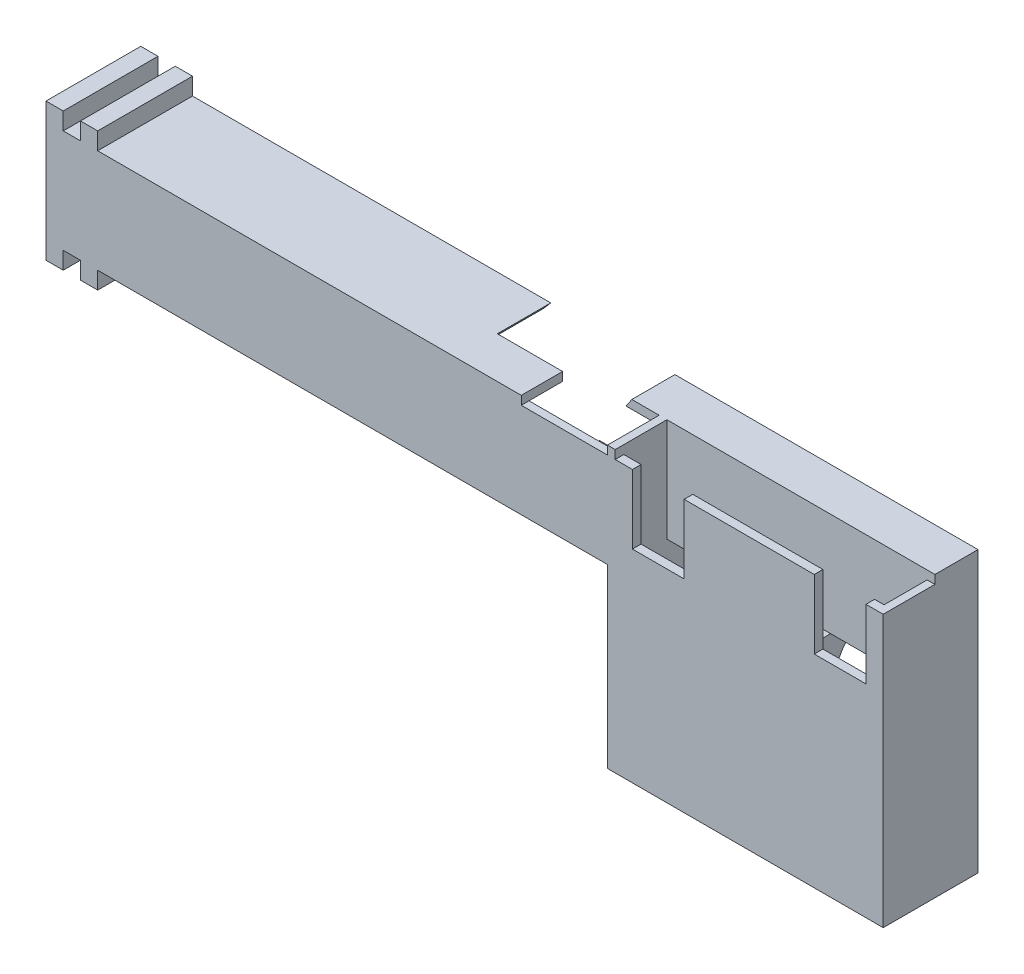
from build123d import *

# Parameters (mm, degrees)
BOSS_EXTRUDE2_DEPTH  = 11
BOSS_EXTRUDE3_DEPTH  = 5
SKETCH2_W            = 30.2
SKETCH2_H            = 1
BOSS_EXTRUDE4_DEPTH  = 25.5
SKETCH1_W            = 7.8
SKETCH1_H            = 14.5
BOSS_EXTRUDE5_DEPTH  = 11
SKETCH3_W            = 11.2
SKETCH3_H            = 11
BOSS_EXTRUDE6_DEPTH  = 5
SKETCH4_W            = 31.1
SKETCH4_H            = 4
CUT_EXTRUDE1_DEPTH   = 10
SKETCH5_W            = 32
SKETCH5_H            = 5
BOSS_EXTRUDE7_DEPTH  = 1
SKETCH7_W            = 5
SKETCH7_H            = 1
SKETCH7_H_2          = 1.003816478
BOSS_EXTRUDE8_DEPTH  = 62.24
SKETCH8_W            = 0.9
SKETCH8_H            = 1
BOSS_EXTRUDE9_DEPTH  = 6
BOSS_EXTRUDE10_DEPTH = 62.26
SKETCH10_W           = 52.24
SKETCH10_H           = 1
BOSS_EXTRUDE11_DEPTH = 6
SKETCH11_R           = 81.7
SKETCH11_R_2         = 70.15
CUT_EXTRUDE2_DEPTH   = 6.2
BOSS_EXTRUDE12_DEPTH = 2.91
SKETCH14_W           = 2
SKETCH14_H           = 11
BOSS_EXTRUDE13_DEPTH = 2
SKETCH15_W           = 2
SKETCH15_H           = 11
BOSS_EXTRUDE14_DEPTH = 2
SKETCH20_RX          = 7.25
SKETCH20_RY          = 5
CUT_EXTRUDE3_DEPTH   = 10
SKETCH21_W           = 6
SKETCH21_H           = 8
CUT_EXTRUDE4_DEPTH   = 1


with BuildPart() as part:
    # Sketch1<3> → Boss-Extrude2 (new body)
    with BuildSketch(Plane.XY):
        Polygon((0, 31.5), (0, 0), (32, 0), (32, 31.5), (31.1, 31.5), (31.1, 6), (0.9, 6), (0.9, 31.5), align=None)
    extrude(amount=BOSS_EXTRUDE2_DEPTH)

    # Sketch1<4> → Boss-Extrude3 (add)
    with BuildSketch(Plane.XY):
        Polygon((0.9, 31.5), (0.9, 20.5), (12.1, 20.5), (19.9, 20.5), (31.1, 20.5), (31.1, 31.5), align=None)
    extrude(amount=BOSS_EXTRUDE3_DEPTH)

    # Sketch2 → Boss-Extrude4 (add)
    with BuildSketch(Plane(origin=(0, 6, 0), x_dir=(1, 0, 0), z_dir=(0, 1, 0))):
        with Locations((16, -10.5)):
            Rectangle(SKETCH2_W, SKETCH2_H)
    extrude(amount=BOSS_EXTRUDE4_DEPTH)

    # Sketch1 → Boss-Extrude5 (add)
    with BuildSketch(Plane.XY):
        with Locations((16, 13.25)):
            Rectangle(SKETCH1_W, SKETCH1_H)
    extrude(amount=BOSS_EXTRUDE5_DEPTH)

    # Sketch3 → Boss-Extrude6 (add)
    with BuildSketch(Plane(origin=(0, 0, 10), x_dir=(-1, 0, 0), z_dir=(0, 0, -1))):
        with Locations((-6.5, 11.5)):
            Rectangle(SKETCH3_W, SKETCH3_H)
        with Locations((-25.5, 11.5)):
            Rectangle(SKETCH3_W, SKETCH3_H)
    extrude(amount=BOSS_EXTRUDE6_DEPTH)

    # Sketch4 → Cut-Extrude1 (cut)
    with BuildSketch(Plane(origin=(0, 31.5, 0), x_dir=(1, 0, 0), z_dir=(0, 1, 0))):
        with Locations((15.55, -2.4)):
            Rectangle(SKETCH4_W, SKETCH4_H)
    extrude(amount=-CUT_EXTRUDE1_DEPTH, mode=Mode.SUBTRACT)

    # Sketch5 → Boss-Extrude7 (add)
    with BuildSketch(Plane(origin=(0, 31.5, 0), x_dir=(1, 0, 0), z_dir=(0, 1, 0))):
        with Locations((16, -2.5)):
            Rectangle(SKETCH5_W, SKETCH5_H)
    extrude(amount=BOSS_EXTRUDE7_DEPTH)

    # Sketch7 → Boss-Extrude8 (add)
    with BuildSketch(Plane.ZY):
        with Locations((2.5, 32)):
            Rectangle(SKETCH7_W, SKETCH7_H)
        with Locations((2.5, 20.998091761)):
            Rectangle(SKETCH7_W, SKETCH7_H_2)
    extrude(amount=BOSS_EXTRUDE8_DEPTH)

    # Sketch8 → Boss-Extrude9 (add)
    with BuildSketch(Plane.XY.offset(5)):
        with Locations((0.45, 32)):
            Rectangle(SKETCH8_W, SKETCH8_H)
    extrude(amount=BOSS_EXTRUDE9_DEPTH)

    # Sketch9 → Boss-Extrude10 (add)
    with BuildSketch(Plane.ZY):
        Polygon((11, 31.5), (10.1, 31.5), (10.1, 21.499511858), (5, 21.499511858), (5, 20.496183522), (11, 20.496183522), align=None)
    extrude(amount=BOSS_EXTRUDE10_DEPTH)

    # Sketch10 → Boss-Extrude11 (add)
    with BuildSketch(Plane.XY.offset(5)):
        with Locations((-36.12, 32)):
            Rectangle(SKETCH10_W, SKETCH10_H)
    extrude(amount=BOSS_EXTRUDE11_DEPTH)

    # Sketch11 → Cut-Extrude2 (cut)
    with BuildSketch(Plane(origin=(0, 0, 0), x_dir=(-1, 0, 0), z_dir=(0, 0, -1))):
        with Locations((71.241875, 77.677250508)):
            Circle(SKETCH11_R)
        with Locations((71.241875, 77.677250508)):
            Circle(SKETCH11_R_2, mode=Mode.SUBTRACT)
    extrude(amount=-CUT_EXTRUDE2_DEPTH, mode=Mode.SUBTRACT)

    # Sketch12 → Boss-Extrude12 (add)
    with BuildSketch(Plane.ZY.offset(62.24)):
        Polygon((11, 32.5), (0, 32.5), (0, 31.5), (10.1, 31.5), (10.1, 21.5), (0, 21.5), (0, 20.496183522), (11, 20.496183522), align=None)
    extrude(amount=BOSS_EXTRUDE12_DEPTH)

    # Sketch14 → Boss-Extrude13 (add)
    with BuildSketch(Plane(origin=(0, 20.496183522, 0), x_dir=(-1, 0, 0), z_dir=(0, -1, 0))):
        with Locations((64.15, -5.5)):
            Rectangle(SKETCH14_W, SKETCH14_H)
        with Locations((60.15, -5.5)):
            Rectangle(SKETCH14_W, SKETCH14_H)
    extrude(amount=BOSS_EXTRUDE13_DEPTH)

    # Sketch15 → Boss-Extrude14 (add)
    with BuildSketch(Plane(origin=(0, 32.5, 0), x_dir=(1, 0, 0), z_dir=(0, 1, 0))):
        with Locations((-64.15, -5.5)):
            Rectangle(SKETCH15_W, SKETCH15_H)
        with Locations((-60.15, -5.5)):
            Rectangle(SKETCH15_W, SKETCH15_H)
    extrude(amount=BOSS_EXTRUDE14_DEPTH)

    # Sketch20 → Cut-Extrude3 (cut)
    with BuildSketch(Plane(origin=(19.9, 0, 0), x_dir=(0, 0, -1), z_dir=(1, 0, 0))):
        with Locations(Location((0, 13.25), (0, 0, -90))):
            Ellipse(SKETCH20_RX, SKETCH20_RY)
    extrude(amount=-CUT_EXTRUDE3_DEPTH, mode=Mode.SUBTRACT)

    # Sketch21 → Cut-Extrude4 (cut)
    with BuildSketch(Plane.XY.offset(11)):
        with Locations((5.9, 27.5)):
            Rectangle(SKETCH21_W, SKETCH21_H)
        with Locations((27, 27.5)):
            Rectangle(SKETCH21_W, SKETCH21_H)
    extrude(amount=-CUT_EXTRUDE4_DEPTH, mode=Mode.SUBTRACT)


solid = part.part
